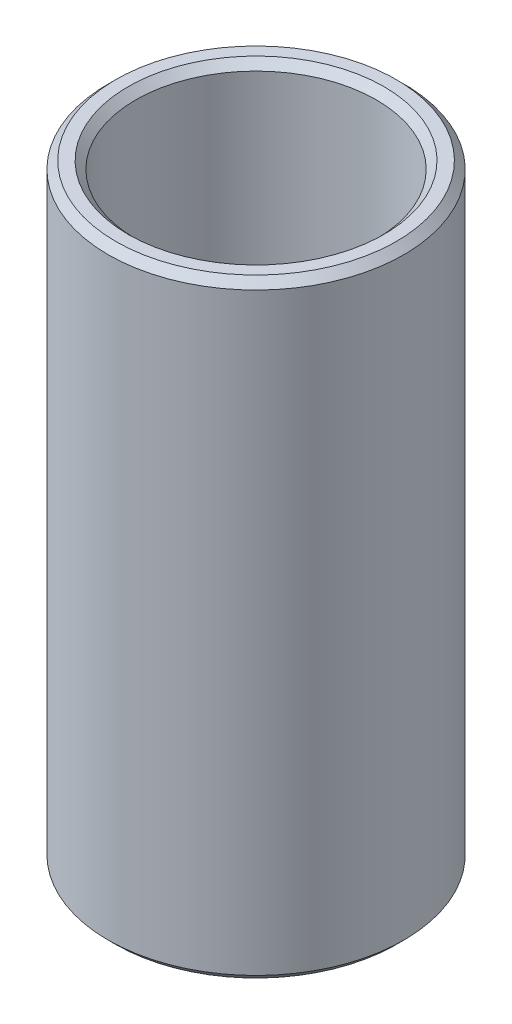
from build123d import *

# Parameters (mm, degrees)
SKETCH1_R           = 40
BOSS_EXTRUDE1_DEPTH = 164.669746575
SKETCH2_R           = 32.549764934
CUT_EXTRUDE1_DEPTH  = 175.115264802
CHAMFER1_SIZE       = 2.06236386


with BuildPart() as part:
    # Sketch1 → Boss-Extrude1 (new body)
    with BuildSketch(Plane(origin=(0, 0, 0), x_dir=(1, 0, 0), z_dir=(0, 1, 0))):
        Circle(SKETCH1_R)
    extrude(amount=BOSS_EXTRUDE1_DEPTH)

    # Sketch2 → Cut-Extrude1 (cut, through all)
    with BuildSketch(Plane(origin=(0, 0, 0), x_dir=(1, 0, 0), z_dir=(0, 1, 0))):
        Circle(SKETCH2_R)
    extrude(amount=CUT_EXTRUDE1_DEPTH, mode=Mode.SUBTRACT)

    # Chamfer1
    chamfer1_edges = [part.edges().sort_by_distance(p)[0] for p in [
        (-32.549764934, 164.669746575, 0),
        (-32.549764934, 0, 0),
        (-40, 0, 0),
        (-40, 164.669746575, 0),
    ]]
    chamfer(chamfer1_edges, length=CHAMFER1_SIZE)


solid = part.part
